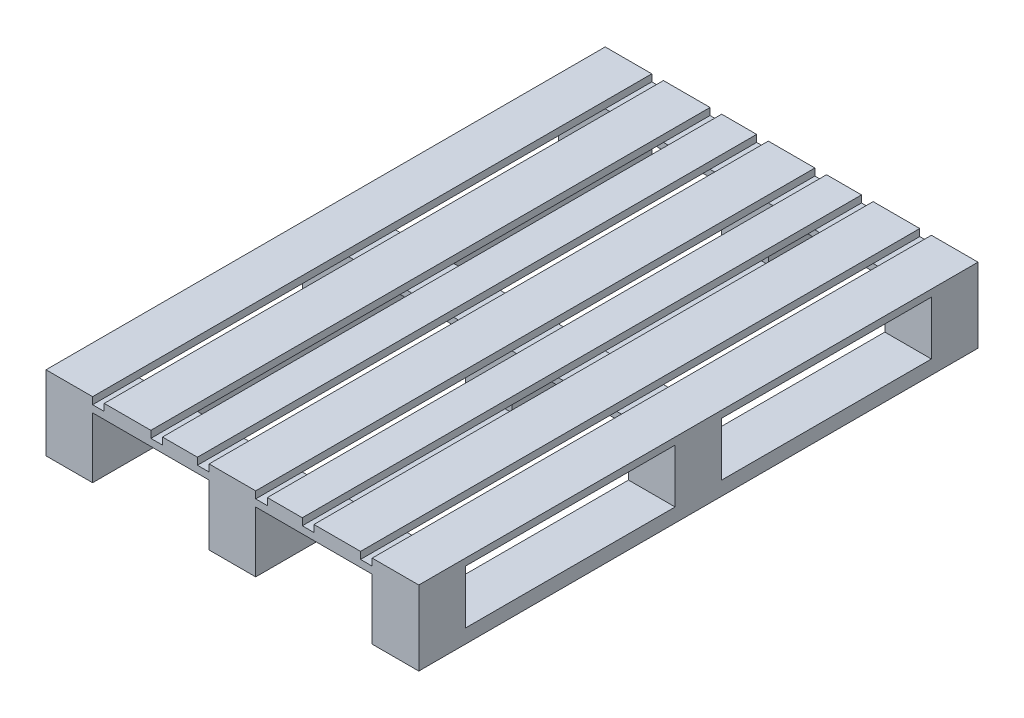
from build123d import *

# Parameters (mm, degrees)
SKETCH1_W              = 800
SKETCH1_H              = 1200
BOSS_EXTRUDE2_DEPTH    = 160
CUT_EXTRUDE2_START     = -800
CUT_EXTRUDE2_OUTLINE_W = 450
CUT_EXTRUDE2_OUTLINE_H = 115
CUT_EXTRUDE2_DEPTH     = 800
SKETCH4_W              = 250
SKETCH4_H              = 130
CUT_EXTRUDE3_DEPTH     = 1452.068571777
SKETCH6_W              = 25
SKETCH6_H              = 1200
CUT_EXTRUDE5_DEPTH     = 15


# Read off the part's stored shape, not the designer's step: Cut-Extrude2
with BuildPart() as part:
    # Sketch1 → Boss-Extrude2 (new body)
    with BuildSketch(Plane(origin=(0, 0, 0), x_dir=(1, 0, 0), z_dir=(0, 1, 0))):
        with Locations((-400, 600)):
            Rectangle(SKETCH1_W, SKETCH1_H)
    extrude(amount=BOSS_EXTRUDE2_DEPTH)

    # Cut-Extrude2 outline → Cut-Extrude2 (cut)
    with BuildSketch(Plane.ZY.offset(800).offset(CUT_EXTRUDE2_START)):
        with Locations((-325, 87.5)):
            Rectangle(CUT_EXTRUDE2_OUTLINE_W, CUT_EXTRUDE2_OUTLINE_H)
        with Locations((-875, 87.5)):
            Rectangle(CUT_EXTRUDE2_OUTLINE_W, CUT_EXTRUDE2_OUTLINE_H)
    extrude(amount=CUT_EXTRUDE2_DEPTH, mode=Mode.SUBTRACT)

    # Sketch4 → Cut-Extrude3 (cut, through all)
    with BuildSketch(Plane.XY):
        with Locations((-575, 65)):
            Rectangle(SKETCH4_W, SKETCH4_H)
        with Locations((-225, 65)):
            Rectangle(SKETCH4_W, SKETCH4_H)
    extrude(amount=-CUT_EXTRUDE3_DEPTH, mode=Mode.SUBTRACT)

    # Sketch6 → Cut-Extrude5 (cut)
    with BuildSketch(Plane(origin=(0, 160, 0), x_dir=(1, 0, 0), z_dir=(0, 1, 0))):
        with Locations((-687.5, 600)):
            Rectangle(SKETCH6_W, SKETCH6_H)
        with Locations((-462.5, 600)):
            Rectangle(SKETCH6_W, SKETCH6_H)
        with Locations((-562.5, 600)):
            Rectangle(SKETCH6_W, SKETCH6_H)
        with Locations((-337.5, 600)):
            Rectangle(SKETCH6_W, SKETCH6_H)
        with Locations((-112.5, 600)):
            Rectangle(SKETCH6_W, SKETCH6_H)
        with Locations((-237.5, 600)):
            Rectangle(SKETCH6_W, SKETCH6_H)
    extrude(amount=-CUT_EXTRUDE5_DEPTH, mode=Mode.SUBTRACT)


solid = part.part
